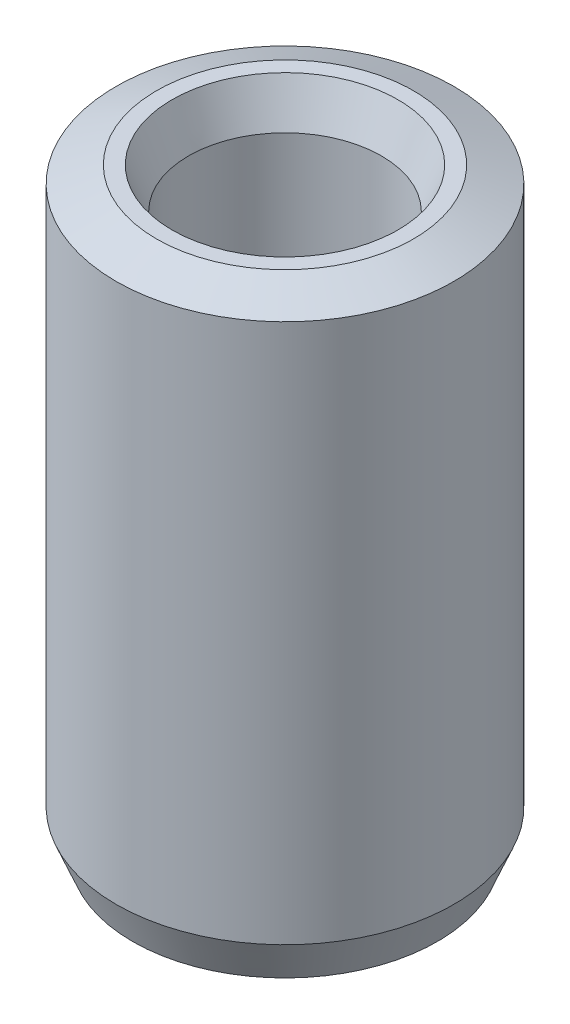
from build123d import *
from OCP.BRepFilletAPI import BRepFilletAPI_MakeChamfer

# Parameters (mm, degrees)
SKETCH1_R           = 15
BOSS_EXTRUDE1_DEPTH = 52.96912521
SKETCH2_R           = 8.56216202
CUT_EXTRUDE1_DEPTH  = 58.058988998
CHAMFER1_SIZE       = 1.46649547
CHAMFER1_SIZE2      = 3.591143977


with BuildPart() as part:
    # Sketch1 → Boss-Extrude1 (new body)
    with BuildSketch(Plane(origin=(0, 0, 0), x_dir=(1, 0, 0), z_dir=(0, 1, 0))):
        Circle(SKETCH1_R)
    extrude(amount=BOSS_EXTRUDE1_DEPTH)

    # Sketch2 → Cut-Extrude1 (cut, through all)
    with BuildSketch(Plane(origin=(0, 0, 0), x_dir=(1, 0, 0), z_dir=(0, 1, 0))):
        Circle(SKETCH2_R)
    extrude(amount=CUT_EXTRUDE1_DEPTH, mode=Mode.SUBTRACT)

    # Chamfer1: one chamfer whose edges measure the first distance from different faces: ONE call of the kernel's chamfer builder (chamfer() names one face for all edges)
    chamfer1_edges_1 = [part.edges().sort_by_distance(p)[0] for p in [
        (-8.56216202, 52.96912521, 0),
    ]]
    chamfer1_side_1 = [part.faces().sort_by_distance(p)[0] for p in [
        (-14.575735931, 52.96912521, 0),
    ]]
    chamfer1_edges_2 = [part.edges().sort_by_distance(p)[0] for p in [
        (-8.56216202, 0, 0),
    ]]
    chamfer1_side_2 = [part.faces().sort_by_distance(p)[0] for p in [
        (-8.56216202, 26.484562605, 0),
    ]]
    chamfer1_edges_3 = [part.edges().sort_by_distance(p)[0] for p in [
        (-15, 0, 0),
    ]]
    chamfer1_side_3 = [part.faces().sort_by_distance(p)[0] for p in [
        (-14.575735931, 0, 0),
    ]]
    chamfer1_edges_4 = [part.edges().sort_by_distance(p)[0] for p in [
        (-15, 52.96912521, 0),
    ]]
    chamfer1_side_4 = [part.faces().sort_by_distance(p)[0] for p in [
        (-15, 26.484562605, 0),
    ]]
    chamfer1 = BRepFilletAPI_MakeChamfer(part.part.solid().wrapped)
    for e in chamfer1_edges_1:
        chamfer1.Add(CHAMFER1_SIZE, CHAMFER1_SIZE2, e.wrapped, chamfer1_side_1[0].wrapped)  # the first distance lies on this face
    for e in chamfer1_edges_2:
        chamfer1.Add(CHAMFER1_SIZE, CHAMFER1_SIZE2, e.wrapped, chamfer1_side_2[0].wrapped)  # the first distance lies on this face
    for e in chamfer1_edges_3:
        chamfer1.Add(CHAMFER1_SIZE, CHAMFER1_SIZE2, e.wrapped, chamfer1_side_3[0].wrapped)  # the first distance lies on this face
    for e in chamfer1_edges_4:
        chamfer1.Add(CHAMFER1_SIZE, CHAMFER1_SIZE2, e.wrapped, chamfer1_side_4[0].wrapped)  # the first distance lies on this face
    add(Compound.cast(chamfer1.Shape()), mode=Mode.REPLACE)


solid = part.part
